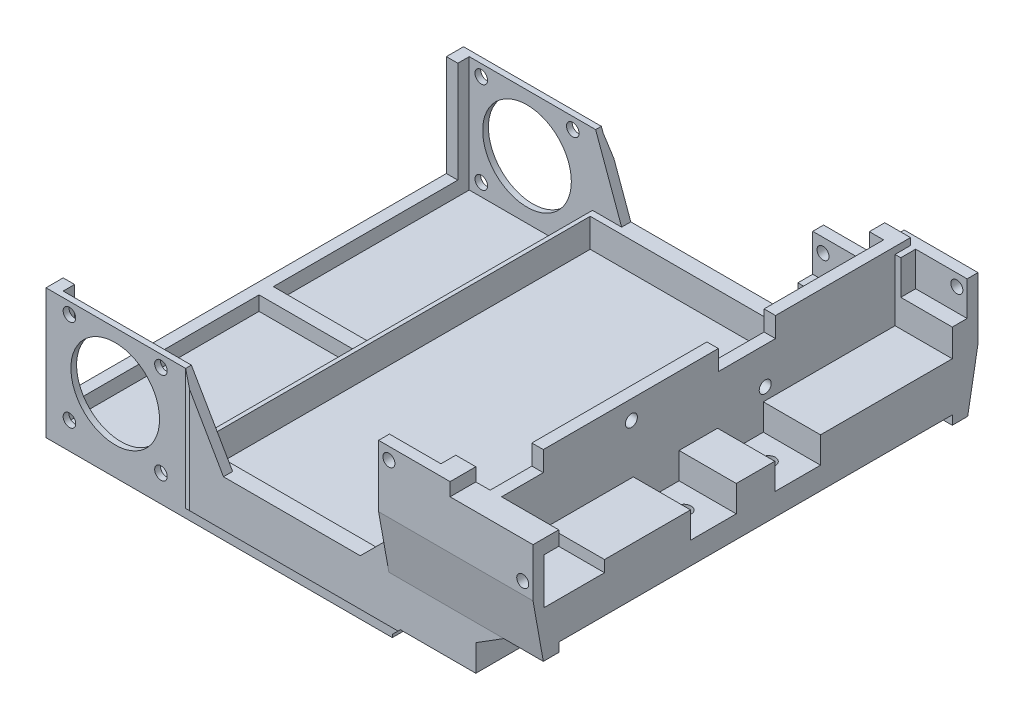
from build123d import *

# Parameters (mm, degrees)
SKETCH5_W                 = 46.8
SKETCH5_H                 = 68.8
BOSS_EXTRUDE2_DEPTH       = 5
BOSS_EXTRUDE4_START       = 2.7
BOSS_EXTRUDE4_DEPTH       = 2.7
BOSS_EXTRUDE5_DEPTH       = 1.575
SKETCH8_W                 = 17.5
SKETCH8_H                 = 74.2
BOSS_EXTRUDE6_DEPTH       = 8.5
BOSS_EXTRUDE7_DEPTH       = 74.2
SKETCH10_W                = 46.8
SKETCH10_H                = 68.8
CUT_EXTRUDE1_DEPTH        = 89.079896259
BOSS_EXTRUDE8_DEPTH       = 5
BOSS_EXTRUDE9_DEPTH       = 5
SKETCH13_W                = 4.5
SKETCH13_H                = 74.2
BOSS_EXTRUDE10_DEPTH      = 12
SKETCH15_R                = 1.25
CUT_EXTRUDE3_DEPTH        = 89.581957108
SKETCH16_W                = 13
SKETCH16_H                = 8
CUT_EXTRUDE4_DEPTH        = 4.6
SKETCH17_W                = 3
SKETCH17_H                = 74.2
CUT_EXTRUDE5_DEPTH        = 89.581957108
SKETCH18_W                = 10
SKETCH18_H                = 3.5
CUT_EXTRUDE6_DEPTH        = 68.525666417
SKETCH19_R                = 1.05
CUT_EXTRUDE7_DEPTH        = 71.890518583
SKETCH20_W                = 2.5
SKETCH20_H                = 68.8
CUT_EXTRUDE8_DEPTH        = 20
BOSS_EXTRUDE11_DEPTH      = 1.8
BOSS_EXTRUDE11_DEPTH_BACK = 2.7
SKETCH21_W                = 10
SKETCH21_H                = 5
SKETCH21_R                = 1.05
BOSS_EXTRUDE13_DEPTH      = 1.8
BOSS_EXTRUDE13_DEPTH_BACK = 2.7
SKETCH23_W                = 27
SKETCH23_H                = 10.8
SKETCH23_R                = 1.05
CUT_EXTRUDE9_DEPTH        = 2.5
CUT_EXTRUDE9_DEPTH_BACK   = 71.358124087
SKETCH24_W                = 27
SKETCH24_H                = 10.075
BOSS_EXTRUDE14_DEPTH      = 2.7
BOSS_EXTRUDE15_DEPTH      = 1.8
BOSS_EXTRUDE15_DEPTH_BACK = 2.7
SKETCH25_R                = 1.05
SKETCH26_W                = 9
SKETCH26_H                = 4.5
CUT_EXTRUDE10_DEPTH       = 2.6
SKETCH27_W                = 9
SKETCH27_H                = 6
CUT_EXTRUDE11_DEPTH       = 2.6
SKETCH28_W                = 9
SKETCH28_H                = 6
CUT_EXTRUDE12_DEPTH       = 2.6
CUT_EXTRUDE13_DEPTH       = 8
CUT_EXTRUDE13_DEPTH_BACK  = 2.6
SKETCH30_W                = 27
SKETCH30_H                = 10.075
BOSS_EXTRUDE16_DEPTH      = 2.7
SKETCH31_W                = 60.55
SKETCH31_H                = 73
BOSS_EXTRUDE17_DEPTH      = 2.5
SKETCH56_W                = 23.55
SKETCH56_H                = 1
BOSS_EXTRUDE36_DEPTH      = 20.2
SKETCH58_W                = 23.55
SKETCH58_H                = 1
BOSS_EXTRUDE37_DEPTH      = 20.2
SKETCH57_R                = 1.1
SKETCH57_R_2              = 7.75
CUT_EXTRUDE18_DEPTH       = 111.049616651
BOSS_EXTRUDE18_DEPTH      = 5
SKETCH49_W                = 2
SKETCH49_H                = 73
BOSS_EXTRUDE33_DEPTH      = 2.5
CHAMFER3_SIZE             = 5
SKETCH50_W                = 9
SKETCH50_H                = 2.6
CUT_EXTRUDE16_DEPTH       = 2
BOSS_EXTRUDE34_REACH      = 101.555
BOSS_EXTRUDE35_START      = -27
BOSS_EXTRUDE35_DEPTH      = 27
SKETCH53_W                = 2
SKETCH53_H                = 68.8
CUT_EXTRUDE17_DEPTH       = 5
CHAMFER4_SIZE             = 1
CHAMFER5_SIZE             = 2
CHAMFER6_SIZE             = 1
CHAMFER7_SIZE             = 2.144506921
CHAMFER7_SIZE_2           = 1
CHAMFER8_SIZE             = 1
CHAMFER8_SIZE_2           = 2.144506921
CHAMFER9_SIZE             = 14
CHAMFER9_SIZE_2           = 5.09558328
CHAMFER10_SIZE            = 14
CHAMFER10_SIZE_2          = 8.082903769
SKETCH59_W                = 2
SKETCH59_H                = 3
BOSS_EXTRUDE38_DEPTH      = 17.7


with BuildPart() as part:
    # Sketch5 → Boss-Extrude2 (new body)
    with BuildSketch(Plane(origin=(0, 0, 0), x_dir=(1, 0, 0), z_dir=(0, 1, 0))):
        with BuildLine():
            Line((63.65, 37.1), (11.45, 37.1))
            Line((11.45, 37.1), (11.45, -37.1))
            Line((11.45, -37.1), (63.65, -37.1))
            Line((63.65, -37.1), (63.65, -3.871759936))
            ThreePointArc((63.65, -3.871759936), (62.605, 0), (63.65, 3.871759936))
            Line((63.65, 3.871759936), (63.65, 37.1))
        make_face()
        with Locations((37.55, 0)):
            Rectangle(SKETCH5_W, SKETCH5_H, mode=Mode.SUBTRACT)
    extrude(amount=BOSS_EXTRUDE2_DEPTH)

    # Sketch6 → Boss-Extrude4 (add)
    with BuildSketch(Plane.XZ.offset(BOSS_EXTRUDE4_START)):
        with BuildLine():
            Line((63.65, -3.871759936), (63.65, -37.1))
            Line((63.65, -37.1), (11.45, -37.1))
            Line((11.45, -37.1), (11.45, 37.1))
            Line((11.45, 37.1), (63.65, 37.1))
            Line((63.65, 37.1), (63.65, 3.871759936))
            ThreePointArc((63.65, 3.871759936), (62.605, 0), (63.65, -3.871759936))
        make_face()
    extrude(amount=-BOSS_EXTRUDE4_DEPTH)

    # Sketch7 → Boss-Extrude5 (add)
    with BuildSketch(Plane(origin=(0, 5, 0), x_dir=(1, 0, 0), z_dir=(0, 1, 0))):
        with BuildLine():
            Line((63.65, -37.1), (55.65, -37.1))
            Line((55.65, -37.1), (55.65, -34.4))
            Line((55.65, -34.4), (60.95, -34.4))
            Line((60.95, -34.4), (60.95, 34.4))
            Line((60.95, 34.4), (55.65, 34.4))
            Line((55.65, 34.4), (55.65, 37.1))
            Line((55.65, 37.1), (63.65, 37.1))
            Line((63.65, 37.1), (63.65, 3.871759936))
            ThreePointArc((63.65, 3.871759936), (62.605, 0), (63.65, -3.871759936))
            Line((63.65, -3.871759936), (63.65, -37.1))
        make_face()
    extrude(amount=BOSS_EXTRUDE5_DEPTH)

    # Sketch8 → Boss-Extrude6 (add)
    with BuildSketch(Plane(origin=(0, 6.575, 0), x_dir=(1, 0, 0), z_dir=(0, 1, 0))):
        with Locations((69.7, 0)):
            Rectangle(SKETCH8_W, SKETCH8_H)
    extrude(amount=BOSS_EXTRUDE6_DEPTH)

    # Sketch9 → Boss-Extrude7 (add, through all)
    with BuildSketch(Plane.XY.offset(37.1)):
        Polygon((60.95, 15.075), (55.65, 6.575), (60.95, 6.575), align=None)
    extrude(amount=-BOSS_EXTRUDE7_DEPTH)

    # Sketch10 → Cut-Extrude1 (cut, through all)
    with BuildSketch(Plane(origin=(0, 0, 0), x_dir=(1, 0, 0), z_dir=(0, 1, 0))):
        with Locations((37.55, 0)):
            Rectangle(SKETCH10_W, SKETCH10_H)
    extrude(amount=CUT_EXTRUDE1_DEPTH, mode=Mode.SUBTRACT)

    # Sketch11 → Boss-Extrude8 (add)
    with BuildSketch(Plane.XY.offset(37.1)):
        Polygon((71.05, 6.575), (63.65, 1.9375), (63.65, 6.575), align=None)
    extrude(amount=-BOSS_EXTRUDE8_DEPTH)

    # Sketch12 → Boss-Extrude9 (add)
    with BuildSketch(Plane(origin=(0, 0, -37.1), x_dir=(-1, 0, 0), z_dir=(0, 0, -1))):
        Polygon((-71.05, 6.575), (-63.65, 1.9375), (-63.65, 6.575), align=None)
    extrude(amount=-BOSS_EXTRUDE9_DEPTH)

    # Sketch13 → Boss-Extrude10 (add)
    with BuildSketch(Plane(origin=(0, 15.075, 0), x_dir=(1, 0, 0), z_dir=(0, 1, 0))):
        with Locations((63.2, 0)):
            Rectangle(SKETCH13_W, SKETCH13_H)
    extrude(amount=BOSS_EXTRUDE10_DEPTH)

    # Sketch15 → Cut-Extrude3 (cut, through all)
    with BuildSketch(Plane(origin=(0, 15.075, 0), x_dir=(1, 0, 0), z_dir=(0, 1, 0))):
        with Locations(Location((70.3, 7.366, 0), (0, 0, 270))):
            Circle(SKETCH15_R)
        with Locations(Location((70.3, -7.366, 0), (0, 0, 270))):
            Circle(SKETCH15_R)
    extrude(amount=-CUT_EXTRUDE3_DEPTH, mode=Mode.SUBTRACT)

    # Sketch16 → Cut-Extrude4 (cut)
    with BuildSketch(Plane(origin=(0, 15.075, 0), x_dir=(1, 0, 0), z_dir=(0, 1, 0))):
        with Locations((71.95, 7.366)):
            Rectangle(SKETCH16_W, SKETCH16_H)
        with Locations((71.95, -7.366)):
            Rectangle(SKETCH16_W, SKETCH16_H)
    extrude(amount=-CUT_EXTRUDE4_DEPTH, mode=Mode.SUBTRACT)

    # Sketch17 → Cut-Extrude5 (cut, through all)
    with BuildSketch(Plane(origin=(0, 15.075, 0), x_dir=(1, 0, 0), z_dir=(0, 1, 0))):
        with Locations((76.95, 0)):
            Rectangle(SKETCH17_W, SKETCH17_H)
    extrude(amount=-CUT_EXTRUDE5_DEPTH, mode=Mode.SUBTRACT)

    # Sketch18 → Cut-Extrude6 (cut, through all)
    with BuildSketch(Plane.ZY.offset(-60.95)):
        with Locations((-8.5, 25.325)):
            Rectangle(SKETCH18_W, SKETCH18_H)
    extrude(amount=-CUT_EXTRUDE6_DEPTH, mode=Mode.SUBTRACT)

    # Sketch19 → Cut-Extrude7 (cut, through all)
    with BuildSketch(Plane(origin=(65.45, 0, 0), x_dir=(0, 0, -1), z_dir=(1, 0, 0))):
        with Locations((-11.7, 23.775)):
            Circle(SKETCH19_R)
        with Locations((11.7, 17.175)):
            Circle(SKETCH19_R)
    extrude(amount=-CUT_EXTRUDE7_DEPTH, mode=Mode.SUBTRACT)

    # Sketch20 → Cut-Extrude8 (cut)
    with BuildSketch(Plane(origin=(0, 27.075, 0), x_dir=(1, 0, 0), z_dir=(0, 1, 0))):
        with Locations((62.2, 0)):
            Rectangle(SKETCH20_W, SKETCH20_H)
    extrude(amount=-CUT_EXTRUDE8_DEPTH, mode=Mode.SUBTRACT)

    # Sketch21 → Boss-Extrude11 (add, two sides: drawn at the far end of the back side and taken through both)
    with BuildSketch(Plane.XY.offset(37.1).offset(-BOSS_EXTRUDE11_DEPTH_BACK)):
        with Locations((70.45, 17.575)):
            Rectangle(SKETCH21_W, SKETCH21_H)
        with Locations((73.65, 17.175)):
            Circle(SKETCH21_R, mode=Mode.SUBTRACT)
    extrude(amount=BOSS_EXTRUDE11_DEPTH + BOSS_EXTRUDE11_DEPTH_BACK)

    # Sketch23 → Boss-Extrude13 (add, two sides: drawn at the far end of the back side and taken through both)
    with BuildSketch(Plane.XY.offset(37.1).offset(-BOSS_EXTRUDE13_DEPTH_BACK)):
        with Locations((61.95, 20.475)):
            Rectangle(SKETCH23_W, SKETCH23_H)
        with Locations((50.25, 23.775)):
            Circle(SKETCH23_R, mode=Mode.SUBTRACT)
        with Locations((73.65, 17.175)):
            Circle(SKETCH23_R, mode=Mode.SUBTRACT)
    extrude(amount=BOSS_EXTRUDE13_DEPTH + BOSS_EXTRUDE13_DEPTH_BACK)

    # Sketch22 → Cut-Extrude9 (cut, two sides: drawn at the far end of the back side and taken through both)
    with BuildSketch(Plane.ZY.offset(-63.45).offset(-CUT_EXTRUDE9_DEPTH_BACK)):
        Polygon((38.9, 27.075), (27.1, 27.075), (27.1, 23.575), (31.375005417, 23.575), (38.9, 23.575), align=None)
    extrude(amount=CUT_EXTRUDE9_DEPTH + CUT_EXTRUDE9_DEPTH_BACK, mode=Mode.SUBTRACT)

    # Sketch24 → Boss-Extrude14 (add)
    with BuildSketch(Plane.XY.offset(37.1)):
        with Locations((61.95, 10.0375)):
            Rectangle(SKETCH24_W, SKETCH24_H)
    extrude(amount=-BOSS_EXTRUDE14_DEPTH)

    # Sketch25 → Boss-Extrude15 (add, two sides: drawn at the far end of the back side and taken through both)
    with BuildSketch(Plane(origin=(0, 0, -37.1), x_dir=(-1, 0, 0), z_dir=(0, 0, -1)).offset(-BOSS_EXTRUDE15_DEPTH_BACK)):
        Polygon((-75.45, 15.075), (-48.45, 15.075), (-48.45, 19.575), (-57.45, 19.575), (-62.55, 25.875), (-75.45, 25.875), align=None)
        with Locations((-73.65, 23.775)):
            Circle(SKETCH25_R, mode=Mode.SUBTRACT)
        with Locations((-50.25, 17.175)):
            Circle(SKETCH25_R, mode=Mode.SUBTRACT)
    extrude(amount=BOSS_EXTRUDE15_DEPTH + BOSS_EXTRUDE15_DEPTH_BACK)

    # Sketch26 → Cut-Extrude10 (cut)
    with BuildSketch(Plane.XY.offset(-34.4)):
        with Locations((52.95, 17.325)):
            Rectangle(SKETCH26_W, SKETCH26_H)
    extrude(amount=-CUT_EXTRUDE10_DEPTH, mode=Mode.SUBTRACT)

    # Sketch27 → Cut-Extrude11 (cut)
    with BuildSketch(Plane(origin=(0, 0, 34.4), x_dir=(-1, 0, 0), z_dir=(0, 0, -1))):
        with Locations((-52.95, 22.875)):
            Rectangle(SKETCH27_W, SKETCH27_H)
    extrude(amount=-CUT_EXTRUDE11_DEPTH, mode=Mode.SUBTRACT)

    # Sketch28 → Cut-Extrude12 (cut)
    with BuildSketch(Plane.XY.offset(-34.4)):
        with Locations((70.95, 22.875)):
            Rectangle(SKETCH28_W, SKETCH28_H)
    extrude(amount=-CUT_EXTRUDE12_DEPTH, mode=Mode.SUBTRACT)

    # Sketch29 → Cut-Extrude13 (cut, two sides: drawn at the far end of the back side and taken through both)
    with BuildSketch(Plane(origin=(0, 0, 34.4), x_dir=(-1, 0, 0), z_dir=(0, 0, -1)).offset(-CUT_EXTRUDE13_DEPTH_BACK)):
        Polygon((-75.45, 15.075), (-75.45, 13.075), (-66.45, 13.075), (-66.45, 21.075), (-75.45, 21.075), align=None)
    extrude(amount=CUT_EXTRUDE13_DEPTH + CUT_EXTRUDE13_DEPTH_BACK, mode=Mode.SUBTRACT)

    # Sketch30 → Boss-Extrude16 (add)
    with BuildSketch(Plane(origin=(0, 0, -37.1), x_dir=(-1, 0, 0), z_dir=(0, 0, -1))):
        with Locations((-61.95, 10.0375)):
            Rectangle(SKETCH30_W, SKETCH30_H)
    extrude(amount=-BOSS_EXTRUDE16_DEPTH)

    # Sketch31 → Boss-Extrude17 (add)
    with BuildSketch(Plane.XZ.offset(2.7)):
        with Locations((18.175, 0)):
            Rectangle(SKETCH31_W, SKETCH31_H)
    extrude(amount=BOSS_EXTRUDE17_DEPTH)

    # Sketch56 → Boss-Extrude36 (add)
    with BuildSketch(Plane(origin=(0, -2.7, 0), x_dir=(1, 0, 0), z_dir=(0, 1, 0))):
        with Locations((-0.325, -36)):
            Rectangle(SKETCH56_W, SKETCH56_H)
    extrude(amount=BOSS_EXTRUDE36_DEPTH)

    # Sketch58 → Boss-Extrude37 (add)
    with BuildSketch(Plane(origin=(0, -2.7, 0), x_dir=(1, 0, 0), z_dir=(0, 1, 0))):
        with Locations((-0.325, 36)):
            Rectangle(SKETCH58_W, SKETCH58_H)
    extrude(amount=BOSS_EXTRUDE37_DEPTH)

    # Sketch57 → Cut-Extrude18 (cut, through all)
    with BuildSketch(Plane.XY.offset(36.5)):
        with Locations((-8, 15.5)):
            Circle(SKETCH57_R)
        with Locations((8, 15.5)):
            Circle(SKETCH57_R)
        with Locations((-8, -0.5)):
            Circle(SKETCH57_R)
        with Locations((8, -0.5)):
            Circle(SKETCH57_R)
        with Locations((0, 7.5)):
            Circle(SKETCH57_R_2)
    extrude(amount=-CUT_EXTRUDE18_DEPTH, mode=Mode.SUBTRACT)

    # Sketch33 → Boss-Extrude18 (add)
    with BuildSketch(Plane.XZ.offset(5.2)):
        Polygon((-12.1, -1.25), (0, -1.25), (11.45, -1.25), (11.45, 1.25), (0, 1.25), (-12.1, 1.25), align=None)
    extrude(amount=-BOSS_EXTRUDE18_DEPTH)

    # Sketch49 → Boss-Extrude33 (add)
    with BuildSketch(Plane(origin=(0, -2.7, 0), x_dir=(1, 0, 0), z_dir=(0, 1, 0))):
        with Locations((-11.1, 0)):
            Rectangle(SKETCH49_W, SKETCH49_H)
    extrude(amount=BOSS_EXTRUDE33_DEPTH)

    # Chamfer3
    chamfer3_edges = [part.edges().sort_by_distance(p)[0] for p in [
        (48.45, 5, 35.75),
        (48.45, 5, -35.75),
    ]]
    chamfer(chamfer3_edges, length=CHAMFER3_SIZE)

    # Sketch50 → Cut-Extrude16 (cut)
    with BuildSketch(Plane(origin=(0, 15.075, 0), x_dir=(1, 0, 0), z_dir=(0, 1, 0))):
        with Locations((52.95, 35.7)):
            Rectangle(SKETCH50_W, SKETCH50_H)
    extrude(amount=-CUT_EXTRUDE16_DEPTH, mode=Mode.SUBTRACT)

    # Boss-Extrude34: up to this face of the body (flat: up to its plane)
    boss_extrude34_end = Plane(part.part.faces().sort_by_distance((48.45, 17.344469648, 36.703268026))[0])
    # Sketch51 → Boss-Extrude34 (add, up to the picked face)
    with BuildSketch(Plane(origin=(75.45, 0, 0), x_dir=(0, 0, -1), z_dir=(1, 0, 0)), mode=Mode.PRIVATE) as boss_extrude34_sk1:
        Polygon((-38.9, 15.075), (-37.1, 15.075), (-37.1, 5), align=None)
    boss_extrude34_tool1 = split(extrude(boss_extrude34_sk1.sketch, amount=-BOSS_EXTRUDE34_REACH, mode=Mode.PRIVATE), bisect_by=boss_extrude34_end, keep=Keep.BOTH, mode=Mode.PRIVATE)
    add(boss_extrude34_tool1.solids().sort_by(Axis((75.45, 11.716667, 37.7), (-1, 0, 0)))[0])

    # Sketch52 → Boss-Extrude35 (add)
    with BuildSketch(Plane(origin=(75.45, 0, 0), x_dir=(0, 0, -1), z_dir=(1, 0, 0)).offset(BOSS_EXTRUDE35_START)):
        Polygon((38.9, 15.075), (37.1, 15.075), (37.1, 5), align=None)
    extrude(amount=BOSS_EXTRUDE35_DEPTH)

    # Sketch53 → Cut-Extrude17 (cut)
    with BuildSketch(Plane(origin=(0, 5, 0), x_dir=(1, 0, 0), z_dir=(0, 1, 0))):
        with Locations((13.15, 0)):
            Rectangle(SKETCH53_W, SKETCH53_H)
    extrude(amount=-CUT_EXTRUDE17_DEPTH, mode=Mode.SUBTRACT)

    # Chamfer4
    # the kernel refuses this chamfer: 1 mm, written as the material it adds along each edge
    with BuildSketch(Plane(origin=(48.45, -2.7, 36.5), x_dir=(0, 0.027495876610586414, 0.9996219169112968), z_dir=(-1, 0, 0))) as chamfer4_piece_1_section:
        Polygon((CHAMFER4_SIZE * 0.999621916911, -CHAMFER4_SIZE * 0.0274958766106), (-CHAMFER4_SIZE * 0.0274958766106, -CHAMFER4_SIZE * 0.999621916911), (0, 0), align=None)
    chamfer4_piece_1 = extrude(amount=37, mode=Mode.PRIVATE)
    chamfer4_piece_1 = split(chamfer4_piece_1, bisect_by=Plane(origin=(29.95, -3.07500946, 37.1), z_dir=(0, 0, -1)), keep=Keep.TOP, mode=Mode.PRIVATE)
    add(chamfer4_piece_1)

    # Chamfer5
    chamfer5_edges = [part.edges().sort_by_distance(p)[0] for p in [
        (48.45, -2.7, 0.3),
    ]]
    chamfer(chamfer5_edges, length=CHAMFER5_SIZE)

    # Chamfer6
    # the kernel refuses this chamfer: 1 mm, written as the material it adds along each edge
    with BuildSketch(Plane(origin=(53.021682988, -2.7, -36.5), x_dir=(0, -0.9996219169112968, 0.027495876610589075), z_dir=(-1, 0, 0))) as chamfer6_piece_1_section:
        Polygon((CHAMFER6_SIZE * 0.999621916911, -CHAMFER6_SIZE * 0.0274958766106), (-CHAMFER6_SIZE * 0.0274958766106, -CHAMFER6_SIZE * 0.999621916911), (0, 0), align=None)
    chamfer6_piece_1 = extrude(amount=41.571682988, mode=Mode.PRIVATE)
    chamfer6_piece_1 = split(chamfer6_piece_1, bisect_by=Plane(origin=(30.763304158, -3.073391684, -37.1), z_dir=(0, 0, 1)), keep=Keep.TOP, mode=Mode.PRIVATE)
    chamfer6_piece_1 = split(chamfer6_piece_1, bisect_by=Plane(origin=(40.419956237, -12.730043763, -36.743794128), z_dir=(-0.7071067811865476, 0.7071067811865476, 0)), keep=Keep.TOP, mode=Mode.PRIVATE)
    add(chamfer6_piece_1)

    # Chamfer7
    # the kernel refuses this chamfer: 2.144506921, 1 mm, written as the material it takes off along each edge
    with BuildSketch(Plane(origin=(11.45, -8.656364829, 37.1), x_dir=(0.9998669641130705, 0, 0.016311164131111652), z_dir=(0, 1, 0))) as chamfer7_piece_1_section:
        Polygon((CHAMFER7_SIZE * 0.999866963884, CHAMFER7_SIZE * 0.0163111641274), (-CHAMFER7_SIZE_2 * 0.0163111641311, CHAMFER7_SIZE_2 * 0.999866964113), (0, 0), align=None)
    chamfer7_piece_1 = extrude(amount=19.212729659, mode=Mode.PRIVATE)
    chamfer7_piece_1 = split(chamfer7_piece_1, bisect_by=Plane(origin=(12.242917687, 0.81974359, 36.5), z_dir=(0, 0, 1)), keep=Keep.TOP, mode=Mode.PRIVATE)
    add(chamfer7_piece_1, mode=Mode.SUBTRACT)

    # Chamfer8
    # the kernel refuses this chamfer: 2.144506921, 1 mm, written as the material it takes off along each edge
    with BuildSketch(Plane(origin=(11.45, -8.656364829, -37.1), x_dir=(-0.07481330637060045, 0, 0.9971975577536774), z_dir=(0, 1, 0))) as chamfer8_piece_1_section:
        Polygon((CHAMFER8_SIZE * 0.997197557754, CHAMFER8_SIZE * 0.0748133063706), (-CHAMFER8_SIZE_2 * 0.0748133063535, CHAMFER8_SIZE_2 * 0.997197557526), (0, 0), align=None)
    chamfer8_piece_1 = extrude(amount=19.212729659, mode=Mode.PRIVATE)
    chamfer8_piece_1 = split(chamfer8_piece_1, bisect_by=Plane(origin=(12.273570779, 0.95, -36.5), z_dir=(0, 0, -1)), keep=Keep.TOP, mode=Mode.PRIVATE)
    add(chamfer8_piece_1, mode=Mode.SUBTRACT)

    # Chamfer9
    # the kernel refuses this chamfer: 14, 5.09558328 mm, written as the material it adds along each edge
    with BuildSketch(Plane(origin=(11.45, 5, -36.5), x_dir=(-0.013184058198645885, 0.9999130865277316, 0), z_dir=(0, 0, 1))) as chamfer9_piece_1_section:
        Polygon((CHAMFER9_SIZE * 0.999913086528, -CHAMFER9_SIZE * 0.0131840581986), (-CHAMFER9_SIZE_2 * 0.0131840581979, -CHAMFER9_SIZE_2 * 0.999913086474), (0, 0), align=None)
    chamfer9_piece_1 = extrude(amount=1, mode=Mode.PRIVATE)
    chamfer9_piece_1 = split(chamfer9_piece_1, bisect_by=Plane(origin=(11.719015339, 17.5, -36.362721956), z_dir=(0, -1, 0)), keep=Keep.TOP, mode=Mode.PRIVATE)
    add(chamfer9_piece_1)
    with BuildSketch(Plane(origin=(11.45, 5, -72.818726256), x_dir=(-0.013184058198645885, 0.9999130865277316, 0), z_dir=(0, 0, 1))) as chamfer9_piece_2_section:
        Polygon((CHAMFER9_SIZE * 0.999913086528, -CHAMFER9_SIZE * 0.0131840581986), (-CHAMFER9_SIZE_2 * 0.0131840581979, -CHAMFER9_SIZE_2 * 0.999913086474), (0, 0), align=None)
    chamfer9_piece_2 = extrude(amount=37.318726256, mode=Mode.PRIVATE)
    chamfer9_piece_2 = split(chamfer9_piece_2, bisect_by=Plane(origin=(14.098660191, 17.5, -36.764581043), z_dir=(0, -1, 0)), keep=Keep.TOP, mode=Mode.PRIVATE)
    chamfer9_piece_2 = split(chamfer9_piece_2, bisect_by=Plane(origin=(13.880142379, 8.361432967, -37.233194002), z_dir=(0.4226182617403224, 0, 0.9063077870368258)), keep=Keep.TOP, mode=Mode.PRIVATE)
    chamfer9_piece_2 = split(chamfer9_piece_2, bisect_by=Plane(origin=(14.098660191, 8.361432967, -37.1), z_dir=(0, 0, 1)), keep=Keep.TOP, mode=Mode.PRIVATE)
    add(chamfer9_piece_2)

    # Chamfer10
    # the kernel refuses this chamfer: 14, 8.082903769 mm, written as the material it adds along each edge
    with BuildSketch(Plane(origin=(11.45, 5, 35.5), x_dir=(-0.01932676561270054, 0.9998132206222078, 0), z_dir=(0, 0, 1))) as chamfer10_piece_1_section:
        Polygon((CHAMFER10_SIZE * 0.999813220622, -CHAMFER10_SIZE * 0.0193267656127), (-CHAMFER10_SIZE_2 * 0.0193267656119, -CHAMFER10_SIZE_2 * 0.99981322058), (0, 0), align=None)
    chamfer10_piece_1 = extrude(amount=1, mode=Mode.PRIVATE)
    chamfer10_piece_1 = split(chamfer10_piece_1, bisect_by=Plane(origin=(11.824948512, 17.5, 35.887420681), z_dir=(0, -1, 0)), keep=Keep.TOP, mode=Mode.PRIVATE)
    add(chamfer10_piece_1)
    with BuildSketch(Plane(origin=(11.45, 5, -0.719200565), x_dir=(-0.01932676561270078, 0.9998132206222078, 0), z_dir=(0, 0, 1))) as chamfer10_piece_2_section:
        Polygon((CHAMFER10_SIZE * 0.999813220622, -CHAMFER10_SIZE * 0.0193267656127), (-CHAMFER10_SIZE_2 * 0.0193267656119, -CHAMFER10_SIZE_2 * 0.99981322058), (0, 0), align=None)
    chamfer10_piece_2 = extrude(amount=73.43840113, mode=Mode.PRIVATE)
    chamfer10_piece_2 = split(chamfer10_piece_2, bisect_by=Plane(origin=(15.117210424, 8.824102591, 37.1), z_dir=(0, 0, -1)), keep=Keep.TOP, mode=Mode.PRIVATE)
    chamfer10_piece_2 = split(chamfer10_piece_2, bisect_by=Plane(origin=(14.722875329, 8.824102591, 37.62616683), z_dir=(0.422618261740698, 0, -0.9063077870366507)), keep=Keep.TOP, mode=Mode.PRIVATE)
    chamfer10_piece_2 = split(chamfer10_piece_2, bisect_by=Plane(origin=(15.117210424, 8.824102591, 36.5), z_dir=(0, 0, 1)), keep=Keep.TOP, mode=Mode.PRIVATE)
    chamfer10_piece_2 = split(chamfer10_piece_2, bisect_by=Plane(origin=(15.117210424, 17.5, 36.780512488), z_dir=(0, -1, 0)), keep=Keep.TOP, mode=Mode.PRIVATE)
    add(chamfer10_piece_2)

    # Sketch59 → Boss-Extrude38 (add)
    with BuildSketch(Plane(origin=(0, -0.2, 0), x_dir=(1, 0, 0), z_dir=(0, 1, 0))):
        with Locations((-11.1, -35)):
            Rectangle(SKETCH59_W, SKETCH59_H)
        with Locations((-11.1, 35)):
            Rectangle(SKETCH59_W, SKETCH59_H)
    extrude(amount=BOSS_EXTRUDE38_DEPTH)


solid = part.part
